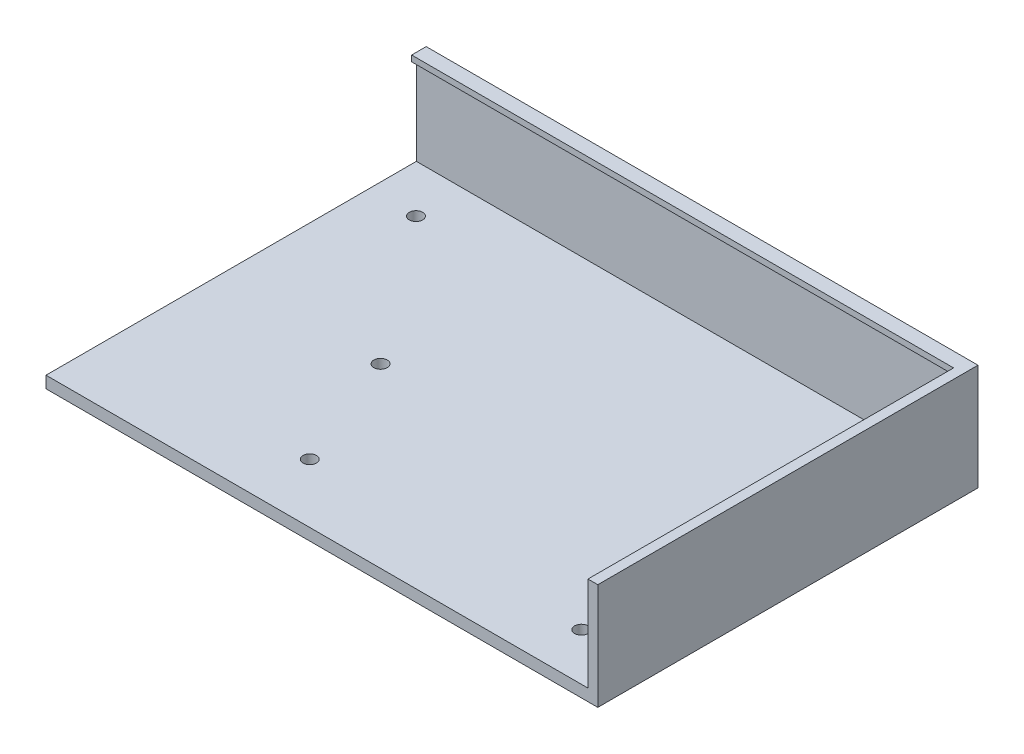
from build123d import *

# Parameters (mm, degrees)
SKETCH1_W                     = 280.4
SKETCH1_H                     = 193.2
SHELL_BLOCK_DEPTH             = 27
SKETCH2_W                     = 275.4
SKETCH2_H                     = 185.8
FRONT_OPENING_DEPTH           = 1.5
SKETCH3_W                     = 275.4
SKETCH3_H                     = 188.2
DISPLAY_POCKET_DEPTH          = 22.5
SKETCH4_W                     = 3
SKETCH4_H                     = 56
VENT_SLOTS_DEPTH              = 4
SKETCH5_W                     = 70
SKETCH5_H                     = 16
CABLE_EXIT_X_SHORT_SIDE_DEPTH = 141.2
SKETCH6_R                     = 1.7
BOLT_HOLES_DEPTH              = 4
KEEP_ONE_HALF_X_DEPTH         = 173.385034153
KEEP_ONE_HALF_X_DEPTH_BACK    = 173.385034153
SKETCH7_W                     = 200
SKETCH7_H                     = 400
KEEP_ONE_QUARTER_Z_DEPTH      = 173.385034153
KEEP_ONE_QUARTER_Z_DEPTH_BACK = 173.385034153
SKETCH8_W                     = 400
SKETCH8_H                     = 200


with BuildPart() as part:
    # Sketch1 → Shell Block (new body)
    with BuildSketch(Plane(origin=(0, 0, 0), x_dir=(1, 0, 0), z_dir=(0, 1, 0))):
        Rectangle(SKETCH1_W, SKETCH1_H)
    extrude(amount=SHELL_BLOCK_DEPTH)

    # Sketch2 → Front Opening (cut)
    with BuildSketch(Plane(origin=(0, 27, 0), x_dir=(1, 0, 0), z_dir=(0, 1, 0))):
        Rectangle(SKETCH2_W, SKETCH2_H)
    extrude(amount=-FRONT_OPENING_DEPTH, mode=Mode.SUBTRACT)

    # Sketch3 → Display Pocket (cut)
    with BuildSketch(Plane(origin=(0, 25.5, 0), x_dir=(1, 0, 0), z_dir=(0, 1, 0))):
        Rectangle(SKETCH3_W, SKETCH3_H)
    extrude(amount=-DISPLAY_POCKET_DEPTH, mode=Mode.SUBTRACT)

    # Sketch4 → Vent Slots (cut)
    with BuildSketch(Plane(origin=(0, 3, 0), x_dir=(1, 0, 0), z_dir=(0, 1, 0))):
        with Locations((-67.5, 56)):
            Rectangle(SKETCH4_W, SKETCH4_H)
        with Locations((-67.5, -56)):
            Rectangle(SKETCH4_W, SKETCH4_H)
        with Locations((-75.5, 56)):
            Rectangle(SKETCH4_W, SKETCH4_H)
        with Locations((-75.5, -56)):
            Rectangle(SKETCH4_W, SKETCH4_H)
        with Locations((-83.5, 56)):
            Rectangle(SKETCH4_W, SKETCH4_H)
        with Locations((-83.5, -56)):
            Rectangle(SKETCH4_W, SKETCH4_H)
        with Locations((-91.5, 56)):
            Rectangle(SKETCH4_W, SKETCH4_H)
        with Locations((-91.5, -56)):
            Rectangle(SKETCH4_W, SKETCH4_H)
        with Locations((-99.5, 56)):
            Rectangle(SKETCH4_W, SKETCH4_H)
        with Locations((-99.5, -56)):
            Rectangle(SKETCH4_W, SKETCH4_H)
        with Locations((-107.5, 56)):
            Rectangle(SKETCH4_W, SKETCH4_H)
        with Locations((-107.5, -56)):
            Rectangle(SKETCH4_W, SKETCH4_H)
        with Locations((-115.5, 56)):
            Rectangle(SKETCH4_W, SKETCH4_H)
        with Locations((-115.5, -56)):
            Rectangle(SKETCH4_W, SKETCH4_H)
        with Locations((-123.5, 56)):
            Rectangle(SKETCH4_W, SKETCH4_H)
        with Locations((-123.5, -56)):
            Rectangle(SKETCH4_W, SKETCH4_H)
    extrude(amount=-VENT_SLOTS_DEPTH, mode=Mode.SUBTRACT)

    # Sketch5 → Cable Exit (-X short side) (cut)
    with BuildSketch(Plane(origin=(0, 0, 0), x_dir=(0, 0, -1), z_dir=(1, 0, 0))):
        with Locations((0, 13)):
            Rectangle(SKETCH5_W, SKETCH5_H)
    extrude(amount=-CABLE_EXIT_X_SHORT_SIDE_DEPTH, mode=Mode.SUBTRACT)

    # Sketch6 → Bolt Holes (cut)
    with BuildSketch(Plane(origin=(0, 3, 0), x_dir=(1, 0, 0), z_dir=(0, 1, 0))):
        with Locations((-40, -45)):
            Circle(SKETCH6_R)
        with Locations((-40, 45)):
            Circle(SKETCH6_R)
        with Locations((40, -45)):
            Circle(SKETCH6_R)
        with Locations((40, 45)):
            Circle(SKETCH6_R)
        with Locations((-52, -15)):
            Circle(SKETCH6_R)
        with Locations((-52, 15)):
            Circle(SKETCH6_R)
        with Locations((52, -15)):
            Circle(SKETCH6_R)
        with Locations((52, 15)):
            Circle(SKETCH6_R)
        with Locations((-12, -82)):
            Circle(SKETCH6_R)
        with Locations((-12, 82)):
            Circle(SKETCH6_R)
        with Locations((12, -82)):
            Circle(SKETCH6_R)
        with Locations((12, 82)):
            Circle(SKETCH6_R)
        with Locations((-124, -12)):
            Circle(SKETCH6_R)
        with Locations((-124, 12)):
            Circle(SKETCH6_R)
        with Locations((124, -12)):
            Circle(SKETCH6_R)
        with Locations((124, 12)):
            Circle(SKETCH6_R)
    extrude(amount=-BOLT_HOLES_DEPTH, mode=Mode.SUBTRACT)

    # Sketch7 → Keep one half (X) (cut, two sides: drawn at the far end of the back side and taken through both)
    with BuildSketch(Plane(origin=(0, 0, 0), x_dir=(1, 0, 0), z_dir=(0, 1, 0)).offset(-KEEP_ONE_HALF_X_DEPTH_BACK)):
        with Locations((-100, 0)):
            Rectangle(SKETCH7_W, SKETCH7_H)
    extrude(amount=KEEP_ONE_HALF_X_DEPTH + KEEP_ONE_HALF_X_DEPTH_BACK, mode=Mode.SUBTRACT)

    # Sketch8 → Keep one quarter (Z) (cut, two sides: drawn at the far end of the back side and taken through both)
    with BuildSketch(Plane(origin=(0, 0, 0), x_dir=(1, 0, 0), z_dir=(0, 1, 0)).offset(-KEEP_ONE_QUARTER_Z_DEPTH_BACK)):
        with Locations((0, -100)):
            Rectangle(SKETCH8_W, SKETCH8_H)
    extrude(amount=KEEP_ONE_QUARTER_Z_DEPTH + KEEP_ONE_QUARTER_Z_DEPTH_BACK, mode=Mode.SUBTRACT)


solid = part.part
